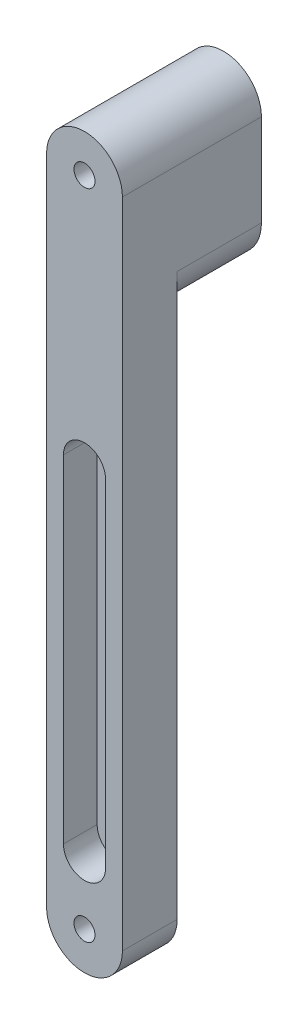
from build123d import *

# Parameters (mm, degrees)
SKETCH1_R      = 2.5
EXTRUDE1_DEPTH = 13
EXTRUDE2_DEPTH = 8
EXTRUDE3_START = 20
EXTRUDE3_DEPTH = 20
FILLET1_R      = 10
FILLET2_R      = 10
SKETCH4_R      = 2.5
EXTRUDE4_DEPTH = 113.911387675


with BuildPart() as part:
    # Sketch1 → Extrude1 (new body)
    with BuildSketch(Plane.XY):
        with BuildLine():
            Line((-9, 56.394324189), (-9, -98.605675811))
            ThreePointArc((-9, -98.605675811), (0, -107.605675811), (9, -98.605675811))
            Line((9, -98.605675811), (9, 56.394324189))
            ThreePointArc((9, 56.394324189), (0, 65.394324189), (-9, 56.394324189))
        make_face()
        with Locations(Location((0, 56.394324189, 0), (0, 0, 180))):
            Circle(SKETCH1_R, mode=Mode.SUBTRACT)
        with Locations(Location((0, -98.605675811, 0), (0, 0, 180))):
            Circle(SKETCH1_R, mode=Mode.SUBTRACT)
    extrude(amount=EXTRUDE1_DEPTH)

    # Sketch2 → Extrude2 (cut)
    with BuildSketch(Plane.XY.offset(13)):
        with BuildLine():
            Line((-5, -3.605675811), (-5, -83.605675811))
            ThreePointArc((-5, -83.605675811), (0, -88.605675811), (5, -83.605675811))
            Line((5, -83.605675811), (5, -3.605675811))
            ThreePointArc((5, -3.605675811), (0, 1.394324189), (-5, -3.605675811))
        make_face()
    extrude(amount=-EXTRUDE2_DEPTH, mode=Mode.SUBTRACT)

    # Sketch3 → Extrude3 (add)
    with BuildSketch(Plane(origin=(0, 0, 0), x_dir=(-1, 0, 0), z_dir=(0, 0, -1)).offset(EXTRUDE3_START)):
        with BuildLine():
            Line((-9, 56.394324189), (-9, 24.585637313))
            Line((-9, 24.585637313), (9, 24.585637313))
            Line((9, 24.585637313), (9, 56.394324189))
            ThreePointArc((9, 56.394324189), (0, 65.394324189), (-9, 56.394324189))
        make_face()
    extrude(amount=-EXTRUDE3_DEPTH)

    # Fillet1
    fillet1_edges = [part.edges().sort_by_distance(p)[0] for p in [
        (9, 24.585637313, -10),
    ]]
    fillet(fillet1_edges, radius=FILLET1_R)

    # Fillet2
    # the kernel refuses this fillet: 10 mm, written as the material it takes off along each edge
    with BuildSketch(Plane(origin=(-9, 24.585637313, -44.494897428), x_dir=(0, 1, 0), z_dir=(0, 0, 1))) as fillet2_piece_1:
        with BuildLine():
            CenterArc((9.797958971, -10), FILLET2_R, 90, 78.463040967)
            Line((0, -8), (-0.195959179, -7.96))
            ThreePointArc((-0.195959179, -7.96), (-0.2, -4), (-0.2, 0))
            Line((-0.2, 0), (0, 0.2))
            Line((0, 0.2), (9.797958971, 0.2))
            Line((9.797958971, 0.2), (9.797958971, 0))
        make_face()
    extrude(amount=44.494897428, mode=Mode.SUBTRACT)

    # Sketch4 → Extrude4 (cut, through all)
    with BuildSketch(Plane.XY.offset(13)):
        with Locations(Location((0, 56.394324189, 0), (0, 0, 180))):
            Circle(SKETCH4_R)
    extrude(amount=-EXTRUDE4_DEPTH, mode=Mode.SUBTRACT)


solid = part.part
